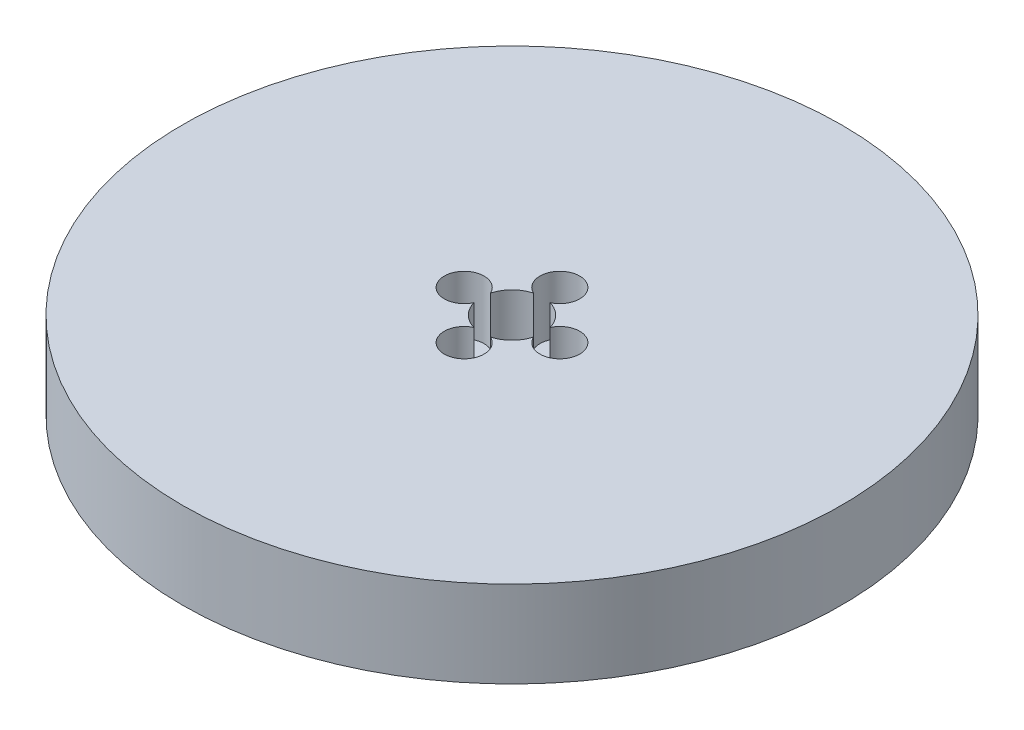
from build123d import *

# Parameters (mm, degrees)
SKETCH1_R           = 80
BOSS_EXTRUDE1_DEPTH = 21
SKETCH2_R           = 7.5
CUT_EXTRUDE1_DEPTH  = 116.06954419
SKETCH3_R           = 4.819696682
CUT_EXTRUDE2_DEPTH  = 14.217775867
CIRPATTERN1_COUNT   = 4


with BuildPart() as part:
    # Sketch1 → Boss-Extrude1 (new body)
    with BuildSketch(Plane(origin=(0, 0, 0), x_dir=(1, 0, 0), z_dir=(0, 1, 0))):
        Circle(SKETCH1_R)
    extrude(amount=BOSS_EXTRUDE1_DEPTH)

    # Sketch2 → Cut-Extrude1 (cut, through all)
    with BuildSketch(Plane(origin=(0, 0, 0), x_dir=(1, 0, 0), z_dir=(0, 1, 0))):
        Circle(SKETCH2_R)
    extrude(amount=CUT_EXTRUDE1_DEPTH, mode=Mode.SUBTRACT)

    # Sketch3 → Cut-Extrude2 (cut)
    with BuildSketch(Plane(origin=(0, 21, 0), x_dir=(1, 0, 0), z_dir=(0, 1, 0))):
        with Locations((-11.608315107, 0)):
            Circle(SKETCH3_R)
    cut_extrude2 = extrude(amount=-CUT_EXTRUDE2_DEPTH, mode=Mode.SUBTRACT)

    # CirPattern1: Cut-Extrude2 ×4 about axis
    cirpattern1_axis = Axis((0, 0, 0), (0, 1, 0))
    for i in range(1, CIRPATTERN1_COUNT):
        add(cut_extrude2.rotate(cirpattern1_axis, i * 360 / CIRPATTERN1_COUNT), mode=Mode.SUBTRACT)


solid = part.part
